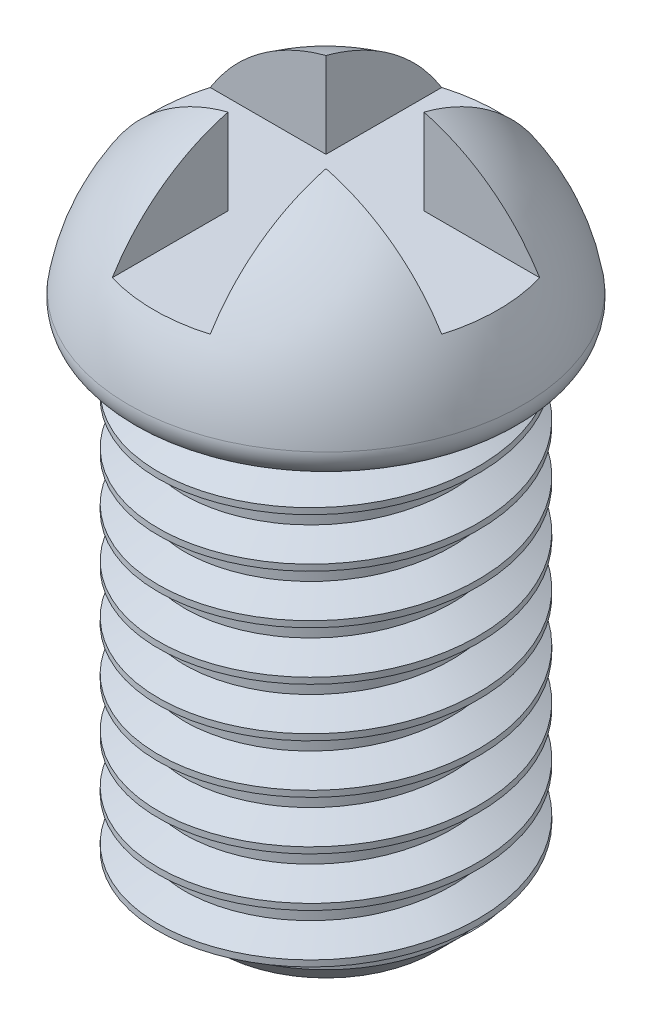
from build123d import *

# Parameters (mm, degrees)
SKETCH2_R           = 1.36
BOSS_EXTRUDE1_DEPTH = 5
CHAMFER1_SIZE       = 0.25
THREAD1_PITCH       = 0.5
FILLET1_R           = 0.25
SKETCH8_R           = 1.766691824
SKETCH8_R_2         = 1.358660465
CUT_EXTRUDE1_DEPTH  = 8.32779524
SKETCH9_W           = 1
SKETCH9_H           = 4.026762732
SKETCH9_W_2         = 4.026762732
SKETCH9_H_2         = 1
CUT_EXTRUDE2_DEPTH  = 1


with BuildPart() as part:
    # Sketch2 → Boss-Extrude1 (new body)
    with BuildSketch(Plane(origin=(0, 0, 0), x_dir=(1, 0, 0), z_dir=(0, 1, 0))):
        with Locations(Location((0, 0, 0), (0, 0, 270))):
            Circle(SKETCH2_R)
    extrude(amount=-BOSS_EXTRUDE1_DEPTH)

    # Chamfer1
    chamfer1_edges = [part.edges().sort_by_distance(p)[0] for p in [
        (0, -5, -1.36),
    ]]
    chamfer(chamfer1_edges, length=CHAMFER1_SIZE)

    # Sketch5 → Revolve1 (revolve)
    with BuildSketch(Plane.XY, mode=Mode.PRIVATE) as revolve1_sk:
        with BuildLine():
            Line((0, 0), (-2.04, 0))
            ThreePointArc((-2.04, 0), (-1.428425707, 1.416594221), (0, 2))
            Line((0, 2), (0, 0))
        make_face()
    revolve(revolve1_sk.sketch.rotate(Axis((0, 0, 0), (0, 1, 0)), 180), axis=Axis((0, 0, 0), (0, 1, 0)))

    # Thread1: the profile of Thread Profile1 profile screwed along a right-hand helix of 9.5 turns, 6 arcs to a turn; built about Z, then put on its axis
    thread1_z = Axis((0, 0, 0), (0, 0, 1))
    thread1_corners = [(1.3597, 0, -0.000173205), (1.630632938, 0, 0.156249999), (1.630632938, 0, 0.218749999), (1.3597, 0, 0.375173204)]
    with BuildLine(mode=Mode.PRIVATE) as thread1_profile:
        Line(thread1_corners[0], thread1_corners[1])
        Line(thread1_corners[1], thread1_corners[2])
        Line(thread1_corners[2], thread1_corners[3])
        Line(thread1_corners[3], thread1_corners[0])
    thread1_cap = Face(thread1_profile.wire())
    thread1_turn_angles = [0, 30, 60, 90, 120, 150, 180, 210, 240, 270, 300, 330, 360]
    thread1_turn_weights = [1, 0.8660254037844387, 1, 0.8660254037844387, 1, 0.8660254037844387, 1, 0.8660254037844387, 1, 0.8660254037844387, 1, 0.8660254037844387, 1]
    thread1_turn_rails = [Edge.make_bspline([Vector(p[0], p[1], 0).rotate(thread1_z, thread1_turn_angles[k]) / thread1_turn_weights[k] + Vector(0, 0, p[2] + THREAD1_PITCH * thread1_turn_angles[k] / 360) for k in range(13)], [0, 0, 0, 1, 1, 2, 2, 3, 3, 4, 4, 5, 5, 6, 6, 6], 2, thread1_turn_weights) for p in thread1_corners]
    thread1_turn_sides = [Face.make_surface_from_curves(thread1_turn_rails[p[0]], thread1_turn_rails[p[1]]) for p in [(0, 1), (1, 2), (2, 3), (3, 0)]]
    thread1_last_angles = [3240, 3270, 3300, 3330, 3360, 3390, 3420]
    thread1_last_weights = [1, 0.8660254037844387, 1, 0.8660254037844387, 1, 0.8660254037844446, 1]
    thread1_last_rails = [Edge.make_bspline([Vector(p[0], p[1], 0).rotate(thread1_z, thread1_last_angles[k]) / thread1_last_weights[k] + Vector(0, 0, p[2] + THREAD1_PITCH * thread1_last_angles[k] / 360) for k in range(7)], [0, 0, 0, 1, 1, 2, 2, 3, 3, 3], 2, thread1_last_weights) for p in thread1_corners]
    thread1_last_sides = [Face.make_surface_from_curves(thread1_last_rails[p[0]], thread1_last_rails[p[1]]) for p in [(0, 1), (1, 2), (2, 3), (3, 0)]]
    thread1 = Plane(origin=(0, 0, 0), x_dir=(-1, 0, 0), z_dir=(0, -1, 0)) * Solid(Shell([*[p.moved(Location((0, 0, THREAD1_PITCH * i))) for i in range(9) for p in thread1_turn_sides], *thread1_last_sides, thread1_cap, thread1_cap.rotate(thread1_z, 3420).moved(Location((0, 0, THREAD1_PITCH * 3420 / 360)))]))
    add(thread1)

    # Fillet1
    fillet1_edges = [part.edges().sort_by_distance(p)[0] for p in [
        (-2.04, 0, 0),
    ]]
    fillet(fillet1_edges, radius=FILLET1_R)

    # Sketch8 → Cut-Extrude1 (cut, through all)
    with BuildSketch(Plane(origin=(0, -4.75, 0), x_dir=(-1, 0, 0), z_dir=(0, -1, 0))):
        Circle(SKETCH8_R)
        Circle(SKETCH8_R_2, mode=Mode.SUBTRACT)
    extrude(amount=CUT_EXTRUDE1_DEPTH, mode=Mode.SUBTRACT)

    # Sketch9 → Cut-Extrude2 (cut)
    with BuildSketch(Plane(origin=(0, 2, 0), x_dir=(1, 0, 0), z_dir=(0, 1, 0))):
        Rectangle(SKETCH9_W, SKETCH9_H)
        Rectangle(SKETCH9_W_2, SKETCH9_H_2)
    extrude(amount=-CUT_EXTRUDE2_DEPTH, mode=Mode.SUBTRACT)


solid = part.part
